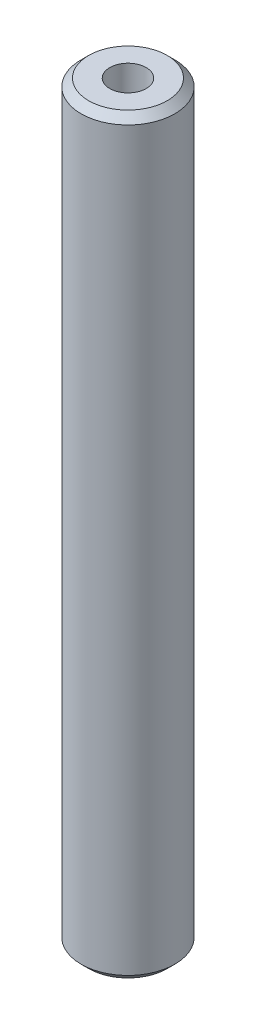
from build123d import *

# Parameters (mm, degrees)
SKETCH1_R           = 22.5
BOSS_EXTRUDE1_DEPTH = 361.170907467
SKETCH2_R           = 8.7531821
CUT_EXTRUDE1_DEPTH  = 363.569888988
CHAMFER1_SIZE       = 3.630674532


with BuildPart() as part:
    # Sketch1 → Boss-Extrude1 (new body)
    with BuildSketch(Plane(origin=(0, 0, 0), x_dir=(1, 0, 0), z_dir=(0, 1, 0))):
        Circle(SKETCH1_R)
    extrude(amount=BOSS_EXTRUDE1_DEPTH)

    # Sketch2 → Cut-Extrude1 (cut, through all)
    with BuildSketch(Plane(origin=(0, 0, 0), x_dir=(1, 0, 0), z_dir=(0, 1, 0))):
        Circle(SKETCH2_R)
    extrude(amount=CUT_EXTRUDE1_DEPTH, mode=Mode.SUBTRACT)

    # Chamfer1
    chamfer1_edges = [part.edges().sort_by_distance(p)[0] for p in [
        (-22.5, 361.170907467, 0),
        (-22.5, 0, 0),
    ]]
    chamfer(chamfer1_edges, length=CHAMFER1_SIZE)


solid = part.part
